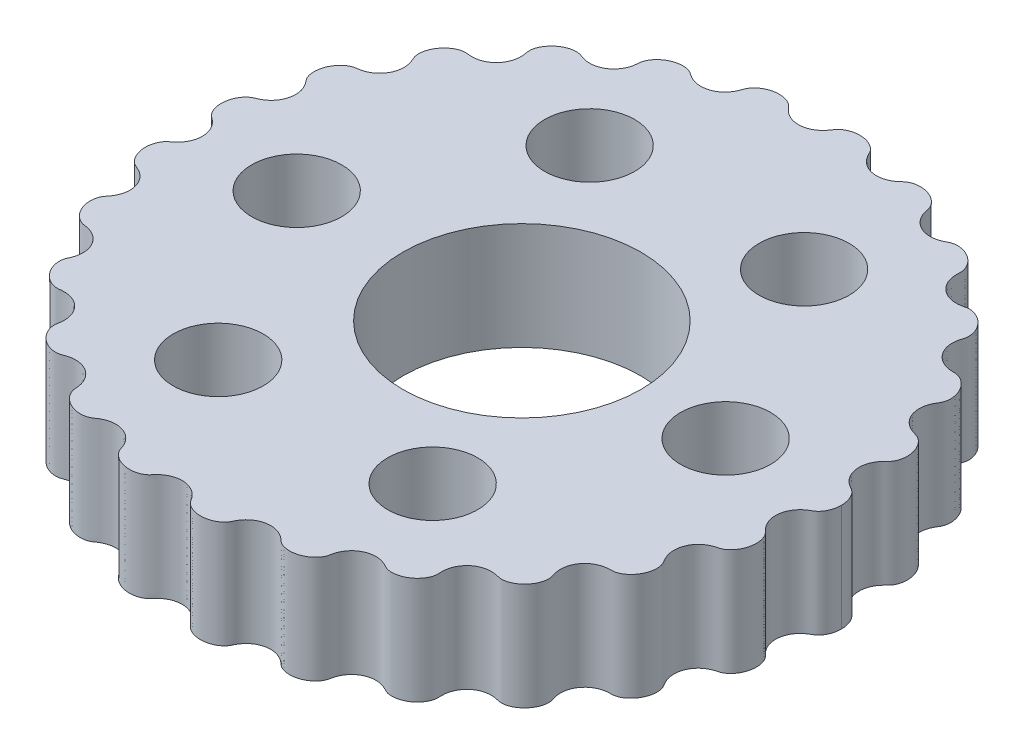
from build123d import *

# Parameters (mm, degrees)
BOSS_EXTRUDE2_DEPTH = 5
SKETCH3_R           = 2.1
CUT_EXTRUDE1_DEPTH  = 23.948222063
SKETCH5_R           = 5.55
CUT_EXTRUDE3_DEPTH  = 23.948222063


with BuildPart() as part:
    # Sketch2 → Boss-Extrude2 (new body)
    with BuildSketch(Plane(origin=(0, 0, 0), x_dir=(1, 0, 0), z_dir=(0, 1, 0))):
        with BuildLine():
            add(Edge.make_bspline(
                [(-15.4, -2.05e-07), (-15.4, 0.017963679), (-15.400999323, 0.054155556), (-15.405496281, 0.123245338), (-15.417452591, 0.205733526), (-15.435300776, 0.284760663), (-15.458936185, 0.363829619), (-15.4955307, 0.460103097), (-15.553831728, 0.577672483), (-15.628963253, 0.690475001), (-15.720523696, 0.795156023), (-15.809877897, 0.878529493), (-15.885972355, 0.939710108), (-15.965266266, 0.996877007), (-16.039390288, 1.060755514), (-16.10181304, 1.136526714), (-16.154322588, 1.219306401), (-16.208602379, 1.329232628), (-16.256294452, 1.468797029), (-16.288096989, 1.63808354), (-16.294503336, 1.881017734), (-16.252297954, 2.119867751), (-16.163760076, 2.344379995), (-16.042398431, 2.523139866), (-15.942454272, 2.628650364), (-15.845311895, 2.703603556), (-15.757199339, 2.750370948), (-15.664408515, 2.786732133), (-15.573413087, 2.826965618), (-15.463621848, 2.885729978), (-15.308968468, 2.990239319), (-15.13050378, 3.165844515), (-14.972147574, 3.434992694), (-14.89398566, 3.773341765), (-14.916927639, 4.080338657), (-14.995171131, 4.310200193), (-15.082412287, 4.468541764), (-15.150259424, 4.567703455), (-15.210025777, 4.642870065), (-15.270573612, 4.717648923), (-15.320176271, 4.800200328), (-15.36541674, 4.910918763), (-15.399338412, 5.049561371), (-15.416852166, 5.262398237), (-15.384340029, 5.500937279), (-15.304055964, 5.731023181), (-15.177986068, 5.941781476), (-15.047854274, 6.095731412), (-14.910789065, 6.208565406), (-14.777136669, 6.28441597), (-14.654566296, 6.325933494), (-14.550559852, 6.341335089), (-14.446683568, 6.355615029), (-14.344145813, 6.378219064), (-14.218558726, 6.416412376), (-14.049117894, 6.490187541), (-13.850381142, 6.623876695), (-13.649361582, 6.848376382), (-13.50607529, 7.152261708), (-13.462998346, 7.451002699), (-13.489971844, 7.692058116), (-13.539204569, 7.862350249), (-13.580286552, 7.968000164), (-13.618269725, 8.050352521), (-13.65443537, 8.133644282), (-13.67828368, 8.221362195), (-13.692937865, 8.335980748), (-13.690655581, 8.476153018), (-13.654303068, 8.685493104), (-13.545223723, 8.951238703), (-13.373056916, 9.183722449), (-13.149188349, 9.366304312), (-12.95326403, 9.463317901), (-12.811586107, 9.506241008), (-12.686731421, 9.522483534), (-12.583488536, 9.516968428), (-12.481158126, 9.503432496), (-12.378198478, 9.496858749), (-12.274929031, 9.498212144), (-12.172138274, 9.508022168), (-12.008489772, 9.538189361), (-11.791017897, 9.615836018), (-11.543764774, 9.778691892), (-11.347433701, 10.024277954), (-11.240209052, 10.268607023), (-11.194325561, 10.48424328), (-11.185347518, 10.63842933), (-11.193136479, 10.770509914), (-11.209146045, 10.879533137), (-11.225593068, 10.966239935), (-11.235972294, 11.053921502), (-11.233096176, 11.14231122), (-11.215768639, 11.253425869), (-11.17671565, 11.384209388), (-11.088557126, 11.571772694), (-10.914554894, 11.800570362), (-10.643928844, 12.015790035), (-10.33839362, 12.131431211), (-10.092328194, 12.151919267), (-9.938831237, 12.124722057), (-9.874147717, 12.104917258), (-9.823296606, 12.086266369), (-9.760021597, 12.062210087), (-9.657742328, 12.026792249), (-9.512708413, 11.991319324), (-9.295428084, 11.971044327), (-9.023341942, 12.005783175), (-8.739745299, 12.120020974), (-8.477485928, 12.330308281), (-8.309271038, 12.575785742), (-8.227745393, 12.796401482), (-8.1948474, 12.964651891), (-8.183073105, 13.072922576), (-8.17740986, 13.159951781), (-8.163855827, 13.268191327), (-8.120743916, 13.39614615), (-8.0432114, 13.535731862), (-7.896275203, 13.715388342), (-7.66781755, 13.896296001), (-7.347778675, 14.038712895), (-7.019984799, 14.072733591), (-6.761854836, 14.026889603), (-6.598537752, 13.94382316), (-6.512636177, 13.880074904), (-6.401772898, 13.805680865), (-6.259871428, 13.730304041), (-6.052431118, 13.656485173), (-5.773826741, 13.622953073), (-5.462558714, 13.668320156), (-5.188838656, 13.799904007), (-4.991154662, 13.966547786), (-4.857833571, 14.133925405), (-4.782594943, 14.263162798), (-4.730894945, 14.379946491), (-4.695923057, 14.480037507), (-4.668902972, 14.560560601), (-4.625076134, 14.657310435), (-4.549395662, 14.764706779), (-4.439982262, 14.875186244), (-4.255657314, 15.006022704), (-3.992826379, 15.120143714), (-3.651468642, 15.175703283), (-3.340640219, 15.129055915), (-3.125824404, 15.033764883), (-3.010951871, 14.946774439), (-2.969759148, 14.9090171), (-2.931738805, 14.868052358), (-2.895415691, 14.825542822), (-2.849862842, 14.772583876), (-2.773475602, 14.691023682), (-2.657607027, 14.589329423), (-2.467715998, 14.468701985), (-2.201270048, 14.37482926), (-1.89427587, 14.35178096), (-1.57047246, 14.423576397), (-1.317305205, 14.563243859), (-1.151543926, 14.714093829), (-1.048134922, 14.841768113), (-0.988592191, 14.928872563), (-0.943008577, 15.000049092), (-0.879486202, 15.084516703), (-0.783319076, 15.171116977), (-0.654507939, 15.252081885), (-0.451621785, 15.335583996), (-0.187231229, 15.385412178), (0.083980966, 15.372590745), (0.34498003, 15.297227978), (0.543453883, 15.192187717), (0.66576514, 15.097631003), (0.754670732, 15.002004334), (0.811224908, 14.912765178), (0.848285284, 14.836852539), (0.894840453, 14.742230041), (0.981133228, 14.596440381), (1.130461791, 14.415291499), (1.371747886, 14.237402645), (1.694146893, 14.124303477), (2.005808039, 14.112082013), (2.279803049, 14.174237301), (2.481366279, 14.271328044), (2.607738454, 14.358111968), (2.69285097, 14.429557295), (2.744274129, 14.476276772), (2.785484757, 14.51360244), (2.839037447, 14.557815738), (2.971848233, 14.642560667), (3.209212349, 14.716335796), (3.537870386, 14.723205434), (3.870973416, 14.623309269), (4.119164878, 14.474113069), (4.287203055, 14.31612725), (4.381819525, 14.188748759), (4.441586957, 14.068624232), (4.469754728, 13.963936145), (4.486205479, 13.878817966), (4.510615897, 13.773375535), (4.56278618, 13.611201221), (4.668640388, 13.402850048), (4.861501992, 13.180789946), (5.140858175, 13.003604669), (5.432389302, 12.920478464), (5.707047343, 12.913934821), (5.924587678, 12.957967892), (6.070502919, 13.011925861), (6.171892992, 13.061226214), (6.234172826, 13.094293248), (6.284238606, 13.120335599), (6.348454819, 13.149381948), (6.450393219, 13.181304737), (6.592860436, 13.199324004), (6.822504707, 13.187512872), (7.108179515, 13.101881159), (7.360700323, 12.948080853), (7.564054881, 12.739256693), (7.686860665, 12.541024702), (7.745859353, 12.391332834), (7.771139717, 12.257944233), (7.769723907, 12.148157634), (7.76448914, 12.060598827), (7.763284165, 11.95102404), (7.773134801, 11.821211136), (7.801859753, 11.673188623), (7.87293797, 11.471739396), (8.004528847, 11.249997743), (8.220498532, 11.035105729), (8.499738312, 10.89046096), (8.747534024, 10.836883967), (8.938296488, 10.832212162), (9.067515607, 10.843723213), (9.169837851, 10.860856567), (9.270401728, 10.885914575), (9.371725276, 10.908894391), (9.499541204, 10.914402089), (9.649899787, 10.893031037), (9.864422414, 10.823594428), (10.115447301, 10.670178455), (10.318488658, 10.460804142), (10.461426996, 10.211874299), (10.524753243, 10.013390562), (10.546392192, 9.877676604), (10.54871035, 9.764592768), (10.539340364, 9.676133747), (10.516898828, 9.590205854), (10.48959357, 9.505763383), (10.460576872, 9.398789945), (10.43711637, 9.267753917), (10.428038925, 9.112622995), (10.448899742, 8.891731308), (10.525306811, 8.644377853), (10.68056024, 8.391693218), (10.908335394, 8.189291397), (11.146089938, 8.066430672), (11.351541146, 8.011177283), (11.50904153, 7.991838534), (11.640826934, 7.98945957), (11.746564253, 7.988165256), (11.874375993, 7.96382694), (12.017764746, 7.905878808), (12.169249377, 7.811410828), (12.319018228, 7.674673468), (12.471981875, 7.480513724), (12.581459021, 7.260882467), (12.64401362, 7.026574152), (12.652861265, 6.812938782), (12.636539544, 6.672849171), (12.606445882, 6.560513083), (12.570431516, 6.476445017), (12.52316631, 6.39823655), (12.475169759, 6.320636846), (12.42152338, 6.219947717), (12.352206783, 6.055608513), (12.297223467, 5.817804557), (12.306144255, 5.511230696), (12.418271092, 5.185791349), (12.599550956, 4.937284492), (12.788421931, 4.782569505), (12.950444571, 4.693121486), (13.068010823, 4.644080383), (13.164678459, 4.612080373), (13.263358977, 4.586967272), (13.360622851, 4.556202595), (13.472064743, 4.497212206), (13.590575024, 4.405386665), (13.741515843, 4.240875618), (13.885567918, 3.984038784), (13.960547447, 3.700012334), (13.962477139, 3.409355761), (13.917122724, 3.199363886), (13.864866305, 3.065549292), (13.804762582, 2.961266737), (13.743749695, 2.885984597), (13.673498703, 2.819365), (13.604760054, 2.751452976), (13.541077576, 2.678634064), (13.482882444, 2.601335324), (13.398435151, 2.468447477), (13.309916002, 2.267780509), (13.257239644, 1.991629003), (13.294765521, 1.65270996), (13.415656685, 1.372495963), (13.564768534, 1.180601297), (13.700945725, 1.058516148), (13.801501699, 0.985659878), (13.885953476, 0.933564636), (13.973240527, 0.886145625), (14.05595319, 0.830914197), (14.145346016, 0.745701374), (14.234104588, 0.627875457), (14.302099652, 0.49791573), (14.350570879, 0.359468261), (14.378415715, 0.242179326), (14.393222635, 0.147286921), (14.398767776, 0.063517674), (14.4, 0.021212111), (14.4, -1.99e-07)],
                knots=[0.062565796, 0.062565796, 0.062565796, 0.062565796, 0.062565796, 0.063859973, 0.06515415, 0.066448326, 0.067742503, 0.06903668, 0.070330857, 0.07291921, 0.075992333, 0.077528894, 0.079065456, 0.080602017, 0.082138578, 0.08367514, 0.085211701, 0.086753761, 0.088295822, 0.091379943, 0.094464064, 0.097548185, 0.103528845, 0.106519174, 0.109509504, 0.111075374, 0.112641243, 0.114207112, 0.115772981, 0.117338851, 0.11890472, 0.122036458, 0.127492162, 0.132947866, 0.138255082, 0.143562297, 0.146585003, 0.148096356, 0.149607709, 0.151119061, 0.152630414, 0.154141767, 0.15565312, 0.158617995, 0.161582869, 0.167512619, 0.170668106, 0.173823593, 0.17697908, 0.180134567, 0.181785014, 0.183435461, 0.185085908, 0.186736355, 0.188386802, 0.190037249, 0.193338142, 0.198333612, 0.203329082, 0.208757311, 0.21418554, 0.217038738, 0.218465337, 0.219891935, 0.221318534, 0.222745133, 0.224171732, 0.225598331, 0.22856804, 0.23153775, 0.237477169, 0.243508984, 0.246524892, 0.2495408, 0.251163787, 0.252786774, 0.254409762, 0.256032749, 0.257655736, 0.259278723, 0.26090171, 0.262524697, 0.268116353, 0.273708009, 0.279232337, 0.2819945, 0.284756664, 0.287531357, 0.288918704, 0.290306051, 0.291693397, 0.293080744, 0.294468091, 0.295855437, 0.298751953, 0.301648468, 0.307441499, 0.313806246, 0.320170993, 0.321874543, 0.322726318, 0.323578093, 0.324429868, 0.325281643, 0.326985192, 0.330392292, 0.333799391, 0.338941908, 0.344084424, 0.349371027, 0.354657629, 0.357399899, 0.358771034, 0.360142168, 0.361513303, 0.362884438, 0.365626708, 0.368571539, 0.37151637, 0.377406032, 0.383827609, 0.390249186, 0.391929851, 0.393610516, 0.39529118, 0.396971845, 0.400333174, 0.403694503, 0.409075747, 0.41445699, 0.419832854, 0.422520785, 0.425208717, 0.427878342, 0.429213155, 0.430547968, 0.431882781, 0.433217593, 0.435887219, 0.438758038, 0.441628857, 0.447370496, 0.453780785, 0.460191075, 0.461070296, 0.461949517, 0.462828738, 0.463707959, 0.46458718, 0.465466401, 0.467224842, 0.470741726, 0.47425861, 0.479541903, 0.484825197, 0.489835983, 0.494846769, 0.497503724, 0.498832202, 0.500160679, 0.501489157, 0.502817634, 0.505474589, 0.508247059, 0.511019529, 0.516564468, 0.52227034, 0.525123276, 0.527976212, 0.530631288, 0.531958826, 0.533286364, 0.534613902, 0.53594144, 0.538596516, 0.543936045, 0.549275574, 0.554531257, 0.559786941, 0.563284399, 0.566781857, 0.568530587, 0.569404951, 0.570279316, 0.57115368, 0.572028045, 0.573776774, 0.580152949, 0.586529123, 0.592383377, 0.595310504, 0.598237631, 0.600962992, 0.602325673, 0.603688354, 0.605051034, 0.606413715, 0.609139076, 0.614392618, 0.619646159, 0.624660447, 0.629674735, 0.633223523, 0.636772312, 0.638546707, 0.639433904, 0.640321101, 0.641208298, 0.642095495, 0.64386989, 0.647025799, 0.650181709, 0.656493529, 0.662419511, 0.665382503, 0.668345494, 0.671104535, 0.672484055, 0.673863575, 0.675243096, 0.676622616, 0.679381657, 0.682041398, 0.68470114, 0.690020622, 0.695473381, 0.700926139, 0.704188253, 0.70581931, 0.707450368, 0.709081425, 0.710712482, 0.712343539, 0.713974596, 0.717095441, 0.720216286, 0.726457975, 0.732286917, 0.735201388, 0.738115858, 0.739511278, 0.740906697, 0.742302116, 0.743697535, 0.745092954, 0.746488373, 0.749279211, 0.752059022, 0.754838832, 0.760398454, 0.765423781, 0.770449108, 0.773768675, 0.777088241, 0.778748025, 0.780407808, 0.782067591, 0.783727374, 0.786901153, 0.790074931, 0.793248709, 0.796422487, 0.802397424, 0.805384893, 0.808372361, 0.809807963, 0.811243566, 0.812679168, 0.81411477, 0.815550372, 0.816985974, 0.819857178, 0.825317904, 0.830778629, 0.835989797, 0.841200965, 0.844404173, 0.846005778, 0.847607382, 0.849208986, 0.85081059, 0.852412194, 0.854013798, 0.857107086, 0.860200373, 0.866386948, 0.872352981, 0.875335998, 0.878319014, 0.879839881, 0.881360748, 0.882881615, 0.884402482, 0.885923349, 0.887444216, 0.888965083, 0.890485949, 0.895823145, 0.90116034, 0.906397405, 0.911634469, 0.914757263, 0.91631866, 0.917880057, 0.919441454, 0.921002851, 0.922564248, 0.924125645, 0.927182053, 0.930238461, 0.931766665, 0.933294869, 0.934823073, 0.936351277, 0.936351277, 0.936351277, 0.936351277, 0.936351277], degree=4))
            add(Edge.make_bspline(
                [(-15.4, -2.05e-07), (-15.4, -0.017963884), (-15.400999323, -0.054155761), (-15.405496281, -0.123245542), (-15.417452591, -0.205733731), (-15.435300776, -0.284760868), (-15.458936185, -0.363829823), (-15.4955307, -0.460103301), (-15.553831728, -0.577672687), (-15.628963253, -0.690475206), (-15.720523696, -0.795156227), (-15.809877897, -0.878529698), (-15.885972355, -0.939710312), (-15.965266265, -0.996877212), (-16.039390288, -1.060755718), (-16.10181304, -1.136526919), (-16.154322588, -1.219306606), (-16.208602379, -1.329232833), (-16.256294452, -1.468797234), (-16.288096989, -1.638083744), (-16.294503336, -1.881017939), (-16.252297954, -2.119867956), (-16.163760076, -2.344380199), (-16.042398431, -2.52314007), (-15.942454271, -2.628650568), (-15.845311894, -2.703603761), (-15.757199339, -2.750371153), (-15.664408514, -2.786732338), (-15.573413087, -2.826965823), (-15.463621848, -2.885730183), (-15.308968468, -2.990239523), (-15.130503779, -3.165844719), (-14.972147574, -3.434992898), (-14.893985659, -3.773341969), (-14.916927638, -4.080338861), (-14.99517113, -4.310200397), (-15.082412287, -4.468541969), (-15.150259423, -4.56770366), (-15.210025776, -4.642870269), (-15.270573612, -4.717649127), (-15.32017627, -4.800200532), (-15.365416739, -4.910918968), (-15.399338411, -5.049561575), (-15.416852165, -5.262398441), (-15.384340028, -5.500937484), (-15.304055963, -5.731023385), (-15.177986067, -5.941781681), (-15.047854273, -6.095731617), (-14.910789064, -6.20856561), (-14.777136668, -6.284416174), (-14.654566295, -6.325933698), (-14.550559851, -6.341335293), (-14.446683567, -6.355615233), (-14.344145812, -6.378219268), (-14.218558725, -6.41641258), (-14.049117892, -6.490187745), (-13.850381141, -6.6238769), (-13.649361581, -6.848376586), (-13.506075288, -7.152261912), (-13.462998345, -7.451002903), (-13.489971843, -7.69205832), (-13.539204567, -7.862350453), (-13.58028655, -7.968000368), (-13.618269724, -8.050352725), (-13.654435369, -8.133644486), (-13.678283679, -8.221362399), (-13.692937864, -8.335980953), (-13.690655579, -8.476153222), (-13.654303066, -8.685493308), (-13.545223721, -8.951238907), (-13.373056915, -9.183722653), (-13.149188347, -9.366304516), (-12.953264028, -9.463318105), (-12.811586105, -9.506241211), (-12.68673142, -9.522483738), (-12.583488535, -9.516968632), (-12.481158125, -9.5034327), (-12.378198476, -9.496858953), (-12.27492903, -9.498212348), (-12.172138273, -9.508022372), (-12.00848977, -9.538189565), (-11.791017895, -9.615836221), (-11.543764772, -9.778692095), (-11.347433699, -10.024278158), (-11.24020905, -10.268607226), (-11.19432556, -10.484243483), (-11.185347516, -10.638429533), (-11.193136478, -10.770510118), (-11.209146043, -10.879533341), (-11.225593066, -10.966240139), (-11.235972293, -11.053921705), (-11.233096174, -11.142311423), (-11.215768637, -11.253426073), (-11.176715648, -11.384209592), (-11.088557124, -11.571772898), (-10.914554892, -11.800570566), (-10.643928842, -12.015790239), (-10.338393618, -12.131431414), (-10.092328191, -12.151919471), (-9.938831235, -12.12472226), (-9.874147715, -12.104917462), (-9.823296604, -12.086266572), (-9.760021595, -12.06221029), (-9.657742326, -12.026792452), (-9.512708411, -11.991319528), (-9.295428082, -11.971044531), (-9.02334194, -12.005783378), (-8.739745297, -12.120021178), (-8.477485926, -12.330308484), (-8.309271036, -12.575785945), (-8.227745391, -12.796401686), (-8.194847398, -12.964652095), (-8.183073102, -13.072922779), (-8.177409857, -13.159951984), (-8.163855825, -13.26819153), (-8.120743913, -13.396146353), (-8.043211398, -13.535732065), (-7.8962752, -13.715388545), (-7.667817547, -13.896296204), (-7.347778673, -14.038713098), (-7.019984797, -14.072733794), (-6.761854834, -14.026889806), (-6.59853775, -13.943823363), (-6.512636175, -13.880075107), (-6.401772895, -13.805681068), (-6.259871426, -13.730304244), (-6.052431116, -13.656485376), (-5.773826739, -13.622953276), (-5.462558712, -13.668320359), (-5.188838654, -13.799904209), (-4.991154659, -13.966547988), (-4.857833569, -14.133925607), (-4.78259494, -14.263163001), (-4.730894943, -14.379946694), (-4.695923054, -14.48003771), (-4.66890297, -14.560560804), (-4.625076131, -14.657310638), (-4.54939566, -14.764706982), (-4.439982259, -14.875186446), (-4.255657312, -15.006022907), (-3.992826377, -15.120143916), (-3.651468639, -15.175703486), (-3.340640217, -15.129056117), (-3.125824401, -15.033765085), (-3.010951868, -14.946774641), (-2.969759145, -14.909017302), (-2.931738803, -14.86805256), (-2.895415689, -14.825543024), (-2.84986284, -14.772584078), (-2.7734756, -14.691023884), (-2.657607025, -14.589329625), (-2.467715995, -14.468702187), (-2.201270046, -14.374829462), (-1.894275868, -14.351781162), (-1.570472458, -14.423576599), (-1.317305203, -14.563244061), (-1.151543923, -14.714094031), (-1.04813492, -14.841768315), (-0.988592189, -14.928872765), (-0.943008575, -15.000049294), (-0.879486199, -15.084516905), (-0.783319073, -15.171117179), (-0.654507937, -15.252082087), (-0.451621783, -15.335584197), (-0.187231226, -15.38541238), (0.083980968, -15.372590947), (0.344980032, -15.297228179), (0.543453885, -15.192187918), (0.665765143, -15.097631204), (0.754670734, -15.002004536), (0.81122491, -14.91276538), (0.848285287, -14.836852741), (0.894840455, -14.742230243), (0.98113323, -14.596440583), (1.130461793, -14.415291701), (1.371747889, -14.237402846), (1.694146896, -14.124303678), (2.005808041, -14.112082215), (2.279803051, -14.174237503), (2.481366281, -14.271328245), (2.607738457, -14.358112169), (2.692850973, -14.429557496), (2.744274132, -14.476276974), (2.785484759, -14.513602641), (2.83903745, -14.557815939), (2.971848236, -14.642560868), (3.209212351, -14.716335997), (3.537870388, -14.723205635), (3.870973419, -14.62330947), (4.11916488, -14.47411327), (4.287203058, -14.316127451), (4.381819528, -14.18874896), (4.44158696, -14.068624433), (4.46975473, -13.963936346), (4.486205481, -13.878818167), (4.510615899, -13.773375736), (4.562786182, -13.611201422), (4.66864039, -13.402850249), (4.861501994, -13.180790147), (5.140858177, -13.00360487), (5.432389304, -12.920478664), (5.707047345, -12.913935022), (5.924587681, -12.957968092), (6.070502921, -13.011926061), (6.171892994, -13.061226415), (6.234172828, -13.094293449), (6.284238608, -13.1203358), (6.348454821, -13.149382149), (6.450393222, -13.181304937), (6.592860438, -13.199324204), (6.822504709, -13.187513073), (7.108179517, -13.101881359), (7.360700325, -12.948081053), (7.564054883, -12.739256894), (7.686860667, -12.541024903), (7.745859355, -12.391333035), (7.771139719, -12.257944434), (7.76972391, -12.148157835), (7.764489142, -12.060599028), (7.763284167, -11.95102424), (7.773134803, -11.821211337), (7.801859755, -11.673188823), (7.872937972, -11.471739597), (8.004528849, -11.249997944), (8.220498534, -11.035105929), (8.499738314, -10.89046116), (8.747534026, -10.836884168), (8.93829649, -10.832212363), (9.067515609, -10.843723414), (9.169837853, -10.860856768), (9.27040173, -10.885914775), (9.371725278, -10.908894591), (9.499541205, -10.914402289), (9.649899789, -10.893031237), (9.864422416, -10.823594629), (10.115447303, -10.670178655), (10.318488659, -10.460804342), (10.461426998, -10.211874499), (10.524753244, -10.013390762), (10.546392194, -9.877676804), (10.548710352, -9.764592968), (10.539340366, -9.676133947), (10.516898829, -9.590206054), (10.489593571, -9.505763583), (10.460576873, -9.398790145), (10.437116372, -9.267754117), (10.428038926, -9.112623195), (10.448899743, -8.891731508), (10.525306813, -8.644378053), (10.680560241, -8.391693418), (10.908335396, -8.189291597), (11.146089939, -8.066430872), (11.351541147, -8.011177483), (11.509041531, -7.991838734), (11.640826936, -7.98945977), (11.746564255, -7.988165456), (11.874375994, -7.96382714), (12.017764748, -7.905879008), (12.169249379, -7.811411027), (12.319018229, -7.674673667), (12.471981877, -7.480513924), (12.581459023, -7.260882666), (12.644013621, -7.026574351), (12.652861266, -6.812938981), (12.636539545, -6.672849371), (12.606445884, -6.560513283), (12.570431517, -6.476445217), (12.523166311, -6.39823675), (12.47516976, -6.320637046), (12.421523381, -6.219947917), (12.352206784, -6.055608712), (12.297223468, -5.817804757), (12.306144256, -5.511230895), (12.418271093, -5.185791549), (12.599550957, -4.937284691), (12.788421932, -4.782569705), (12.950444572, -4.693121686), (13.068010823, -4.644080583), (13.16467846, -4.612080573), (13.263358978, -4.586967472), (13.360622852, -4.556202795), (13.472064743, -4.497212405), (13.590575025, -4.405386865), (13.741515844, -4.240875817), (13.885567919, -3.984038984), (13.960547448, -3.700012534), (13.96247714, -3.40935596), (13.917122724, -3.199364085), (13.864866306, -3.065549492), (13.804762582, -2.961266936), (13.743749695, -2.885984796), (13.673498703, -2.819365199), (13.604760055, -2.751453176), (13.541077577, -2.678634264), (13.482882445, -2.601335524), (13.398435152, -2.468447677), (13.309916002, -2.267780709), (13.257239645, -1.991629203), (13.294765521, -1.652710159), (13.415656685, -1.372496163), (13.564768534, -1.180601497), (13.700945726, -1.058516348), (13.801501699, -0.985660077), (13.885953477, -0.933564835), (13.973240527, -0.886145824), (14.05595319, -0.830914396), (14.145346016, -0.745701573), (14.234104588, -0.627875656), (14.302099652, -0.49791593), (14.350570879, -0.35946846), (14.378415715, -0.242179525), (14.393222635, -0.147287121), (14.398767777, -0.063517873), (14.4, -0.021212311), (14.4, -1.99e-07)],
                knots=[0.062565796, 0.062565796, 0.062565796, 0.062565796, 0.062565796, 0.063859973, 0.06515415, 0.066448326, 0.067742503, 0.06903668, 0.070330857, 0.07291921, 0.075992333, 0.077528894, 0.079065456, 0.080602017, 0.082138578, 0.08367514, 0.085211701, 0.086753761, 0.088295822, 0.091379943, 0.094464064, 0.097548185, 0.103528845, 0.106519174, 0.109509504, 0.111075374, 0.112641243, 0.114207112, 0.115772981, 0.117338851, 0.11890472, 0.122036458, 0.127492162, 0.132947866, 0.138255082, 0.143562297, 0.146585003, 0.148096356, 0.149607709, 0.151119061, 0.152630414, 0.154141767, 0.15565312, 0.158617995, 0.161582869, 0.167512619, 0.170668106, 0.173823593, 0.17697908, 0.180134567, 0.181785014, 0.183435461, 0.185085908, 0.186736355, 0.188386802, 0.190037249, 0.193338142, 0.198333612, 0.203329082, 0.208757311, 0.21418554, 0.217038738, 0.218465337, 0.219891935, 0.221318534, 0.222745133, 0.224171732, 0.225598331, 0.22856804, 0.23153775, 0.237477169, 0.243508984, 0.246524892, 0.2495408, 0.251163787, 0.252786774, 0.254409762, 0.256032749, 0.257655736, 0.259278723, 0.26090171, 0.262524697, 0.268116353, 0.273708009, 0.279232337, 0.2819945, 0.284756664, 0.287531357, 0.288918704, 0.290306051, 0.291693397, 0.293080744, 0.294468091, 0.295855437, 0.298751953, 0.301648468, 0.307441499, 0.313806246, 0.320170993, 0.321874543, 0.322726318, 0.323578093, 0.324429868, 0.325281643, 0.326985192, 0.330392292, 0.333799391, 0.338941908, 0.344084424, 0.349371027, 0.354657629, 0.357399899, 0.358771034, 0.360142168, 0.361513303, 0.362884438, 0.365626708, 0.368571539, 0.37151637, 0.377406032, 0.383827609, 0.390249186, 0.391929851, 0.393610516, 0.39529118, 0.396971845, 0.400333174, 0.403694503, 0.409075747, 0.41445699, 0.419832854, 0.422520785, 0.425208717, 0.427878342, 0.429213155, 0.430547968, 0.431882781, 0.433217593, 0.435887219, 0.438758038, 0.441628857, 0.447370496, 0.453780785, 0.460191075, 0.461070296, 0.461949517, 0.462828738, 0.463707959, 0.46458718, 0.465466401, 0.467224842, 0.470741726, 0.47425861, 0.479541903, 0.484825197, 0.489835983, 0.494846769, 0.497503724, 0.498832202, 0.500160679, 0.501489157, 0.502817634, 0.505474589, 0.508247059, 0.511019529, 0.516564468, 0.52227034, 0.525123276, 0.527976212, 0.530631288, 0.531958826, 0.533286364, 0.534613902, 0.53594144, 0.538596516, 0.543936045, 0.549275574, 0.554531257, 0.559786941, 0.563284399, 0.566781857, 0.568530587, 0.569404951, 0.570279316, 0.57115368, 0.572028045, 0.573776774, 0.580152949, 0.586529123, 0.592383377, 0.595310504, 0.598237631, 0.600962992, 0.602325673, 0.603688354, 0.605051034, 0.606413715, 0.609139076, 0.614392618, 0.619646159, 0.624660447, 0.629674735, 0.633223523, 0.636772312, 0.638546707, 0.639433904, 0.640321101, 0.641208298, 0.642095495, 0.64386989, 0.647025799, 0.650181709, 0.656493529, 0.662419511, 0.665382503, 0.668345494, 0.671104535, 0.672484055, 0.673863575, 0.675243096, 0.676622616, 0.679381657, 0.682041398, 0.68470114, 0.690020622, 0.695473381, 0.700926139, 0.704188253, 0.70581931, 0.707450368, 0.709081425, 0.710712482, 0.712343539, 0.713974596, 0.717095441, 0.720216286, 0.726457975, 0.732286917, 0.735201388, 0.738115858, 0.739511278, 0.740906697, 0.742302116, 0.743697535, 0.745092954, 0.746488373, 0.749279211, 0.752059022, 0.754838832, 0.760398454, 0.765423781, 0.770449108, 0.773768675, 0.777088241, 0.778748025, 0.780407808, 0.782067591, 0.783727374, 0.786901153, 0.790074931, 0.793248709, 0.796422487, 0.802397424, 0.805384893, 0.808372361, 0.809807963, 0.811243566, 0.812679168, 0.81411477, 0.815550372, 0.816985974, 0.819857178, 0.825317904, 0.830778629, 0.835989797, 0.841200965, 0.844404173, 0.846005778, 0.847607382, 0.849208986, 0.85081059, 0.852412194, 0.854013798, 0.857107086, 0.860200373, 0.866386948, 0.872352981, 0.875335998, 0.878319014, 0.879839881, 0.881360748, 0.882881615, 0.884402482, 0.885923349, 0.887444216, 0.888965083, 0.890485949, 0.895823145, 0.90116034, 0.906397405, 0.911634469, 0.914757263, 0.91631866, 0.917880057, 0.919441454, 0.921002851, 0.922564248, 0.924125645, 0.927182053, 0.930238461, 0.931766665, 0.933294869, 0.934823073, 0.936351277, 0.936351277, 0.936351277, 0.936351277, 0.936351277], degree=4))
        make_face()
    extrude(amount=-BOSS_EXTRUDE2_DEPTH)

    # Sketch3 → Cut-Extrude1 (cut, through all)
    with BuildSketch(Plane(origin=(0, 0, 0), x_dir=(1, 0, 0), z_dir=(0, 1, 0))):
        with Locations((-6, 8.660254038)):
            Circle(SKETCH3_R)
        with Locations((4, 8.660254038)):
            Circle(SKETCH3_R)
        with Locations((9, 0)):
            Circle(SKETCH3_R)
        with Locations((4, -8.660254038)):
            Circle(SKETCH3_R)
        with Locations((-6, -8.660254038)):
            Circle(SKETCH3_R)
        with Locations((-11, 0)):
            Circle(SKETCH3_R)
    extrude(amount=-CUT_EXTRUDE1_DEPTH, mode=Mode.SUBTRACT)

    # Sketch5 → Cut-Extrude3 (cut, through all)
    with BuildSketch(Plane(origin=(0, 0, 0), x_dir=(1, 0, 0), z_dir=(0, 1, 0))):
        with Locations((-0.5, 0)):
            Circle(SKETCH5_R)
    extrude(amount=-CUT_EXTRUDE3_DEPTH, mode=Mode.SUBTRACT)


solid = part.part
